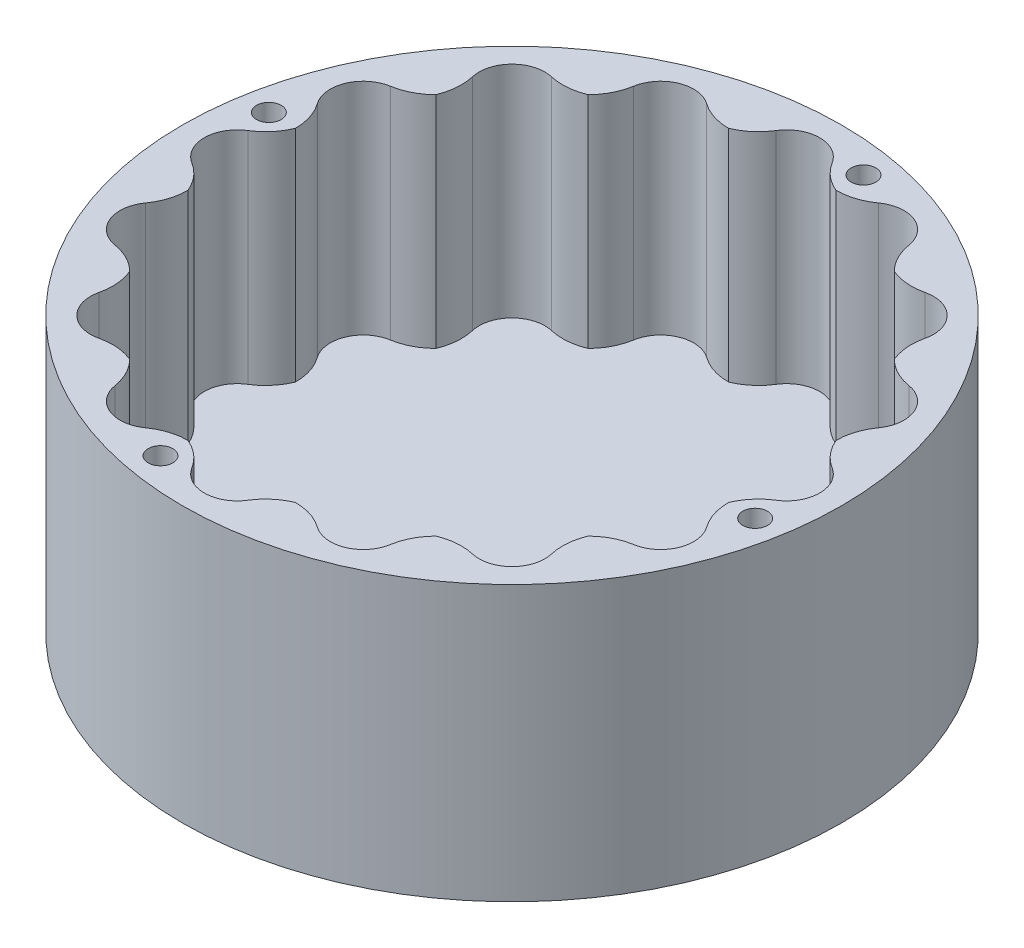
from build123d import *

# Parameters (mm, degrees)
SKETCH1_R           = 59.999999999
BOSS_EXTRUDE1_DEPTH = 50
SKETCH3_R           = 59.999999999
BOSS_EXTRUDE2_DEPTH = 10
FILLET1_R           = 10
FILLET2_R           = 10
SKETCH5_R           = 2.25
CUT_EXTRUDE2_DEPTH  = 6.1


with BuildPart() as part:
    # Sketch1 → Boss-Extrude1 (new body)
    with BuildSketch(Plane(origin=(0, 0, 0), x_dir=(1, 0, 0), z_dir=(0, 1, 0))):
        with Locations(Location((-1.875, 3e-09, 0), (0, 0, 270))):
            Circle(SKETCH1_R)
        with BuildLine():
            ThreePointArc((-50.028343877, 13.463115287), (-50.914264017, 9.754516103), (-51.514999998, 5.989190263))
            ThreePointArc((-51.514999998, 5.989190263), (-57.874999995, 3e-09), (-51.514999998, -5.989190257))
            ThreePointArc((-51.514999998, -5.989190257), (-50.914264017, -9.754516098), (-50.028343877, -13.463115281))
            ThreePointArc((-50.028343877, -13.463115281), (-53.612253816, -21.430272208), (-45.444416106, -24.529695876))
            ThreePointArc((-45.444416106, -24.529695876), (-43.448480613, -27.778511647), (-41.210777663, -30.865783567))
            ThreePointArc((-41.210777663, -30.865783567), (-41.472979743, -39.59797974), (-32.74078357, -39.33577766))
            ThreePointArc((-32.74078357, -39.33577766), (-29.653511649, -41.57348061), (-26.404695879, -43.569416103))
            ThreePointArc((-26.404695879, -43.569416103), (-23.30527221, -51.737253813), (-15.338115284, -48.153343875))
            ThreePointArc((-15.338115284, -48.153343875), (-11.6295161, -49.039264015), (-7.86419026, -49.639999995))
            ThreePointArc((-7.86419026, -49.639999995), (-1.875, -55.999999992), (4.11419026, -49.639999995))
            ThreePointArc((4.11419026, -49.639999995), (7.8795161, -49.039264015), (11.588115284, -48.153343875))
            ThreePointArc((11.588115284, -48.153343875), (19.55527221, -51.737253813), (22.654695879, -43.569416103))
            ThreePointArc((22.654695879, -43.569416103), (25.903511649, -41.57348061), (28.99078357, -39.33577766))
            ThreePointArc((28.99078357, -39.33577766), (37.722979743, -39.59797974), (37.460777663, -30.865783567))
            ThreePointArc((37.460777663, -30.865783567), (39.698480613, -27.778511647), (41.694416106, -24.529695876))
            ThreePointArc((41.694416106, -24.529695876), (49.862253816, -21.430272208), (46.278343877, -13.463115281))
            ThreePointArc((46.278343877, -13.463115281), (47.164264017, -9.754516098), (47.764999998, -5.989190257))
            ThreePointArc((47.764999998, -5.989190257), (54.124999995, 3e-09), (47.764999998, 5.989190263))
            ThreePointArc((47.764999998, 5.989190263), (47.164264017, 9.754516103), (46.278343877, 13.463115287))
            ThreePointArc((46.278343877, 13.463115287), (49.862253816, 21.430272213), (41.694416106, 24.529695882))
            ThreePointArc((41.694416106, 24.529695882), (39.698480613, 27.778511652), (37.460777663, 30.865783572))
            ThreePointArc((37.460777663, 30.865783572), (37.722979743, 39.597979745), (28.99078357, 39.335777666))
            ThreePointArc((28.99078357, 39.335777666), (25.903511649, 41.573480616), (22.654695879, 43.569416109))
            ThreePointArc((22.654695879, 43.569416109), (19.55527221, 51.737253819), (11.588115284, 48.15334388))
            ThreePointArc((11.588115284, 48.15334388), (7.8795161, 49.03926402), (4.11419026, 49.64))
            ThreePointArc((4.11419026, 49.64), (-1.875, 55.999999998), (-7.86419026, 49.64))
            ThreePointArc((-7.86419026, 49.64), (-11.6295161, 49.03926402), (-15.338115284, 48.15334388))
            ThreePointArc((-15.338115284, 48.15334388), (-23.30527221, 51.737253819), (-26.404695879, 43.569416109))
            ThreePointArc((-26.404695879, 43.569416109), (-29.653511649, 41.573480616), (-32.74078357, 39.335777666))
            ThreePointArc((-32.74078357, 39.335777666), (-41.472979743, 39.597979745), (-41.210777663, 30.865783572))
            ThreePointArc((-41.210777663, 30.865783572), (-43.448480613, 27.778511652), (-45.444416106, 24.529695882))
            ThreePointArc((-45.444416106, 24.529695882), (-53.612253816, 21.430272213), (-50.028343877, 13.463115287))
        make_face(mode=Mode.SUBTRACT)
    extrude(amount=BOSS_EXTRUDE1_DEPTH)

    # Sketch3 → Boss-Extrude2 (add)
    with BuildSketch(Plane(origin=(0, 0, 0), x_dir=(1, 0, 0), z_dir=(0, 1, 0))):
        with Locations(Location((-1.875, 3e-09, 0), (0, 0, 270))):
            Circle(SKETCH3_R)
    extrude(amount=BOSS_EXTRUDE2_DEPTH)

    # Fillet1
    # the kernel refuses this fillet: 10 mm, written as the material it takes off along each edge
    with BuildSketch(Plane(origin=(11.588115284, 10, -48.15334388), x_dir=(-0.9762460203923251, 0, -0.2166649664070039), z_dir=(0, 1, 0))) as fillet1_piece_1:
        with BuildLine():
            CenterArc((5.962374186, -9.98529915), FILLET1_R, 93.107148893, 45.06938167)
            ThreePointArc((-1.489654942, -3.316921396), (-0.487517252, -1.774020699), (0, 0))
            ThreePointArc((0, 0), (2.710170085, -0.073504248), (5.420340169, 0))
        make_face()
    extrude(amount=53.550850423, mode=Mode.SUBTRACT)
    with BuildSketch(Plane(origin=(4.11419026, 10, -49.64), x_dir=(0.9848478099539646, 0, 0.17342085004081753), z_dir=(0, 1, 0))) as fillet1_piece_2:
        with BuildLine():
            CenterArc((5.962374186, 9.98529915), FILLET1_R, 221.823469437, 45.06938167)
            ThreePointArc((-1.489654942, 3.316921396), (-0.487517252, 1.774020699), (0, 0))
            ThreePointArc((0, 0), (2.710170085, 0.073504248), (5.420340169, 0))
        make_face()
    extrude(amount=53.550850423, mode=Mode.SUBTRACT)

    # Fillet2
    # the kernel refuses this fillet: 10 mm, written as the material it takes off along each edge
    with BuildSketch(Plane(origin=(-50.028343877, 10, -13.463115287), x_dir=(-0.8017919038554878, 0, -0.5976033324135602), z_dir=(0, 1, 0)), Plane(origin=(-51.514999998, 10, 5.989190257), x_dir=(-0.9694520237461802, 0, -0.24528100956746685), z_dir=(0, 1, 0)), Plane(origin=(-45.444416106, 10, 24.529695876), x_dir=(-0.9895218611259949, 0, 0.14438312350737928), z_dir=(0, 1, 0)), Plane(origin=(-32.74078357, 10, 39.33577766), x_dir=(-0.8589459651873854, 0, 0.5120662348645055), z_dir=(0, 1, 0)), Plane(origin=(-15.338115284, 10, 48.153343875), x_dir=(-0.5976033324135606, 0, 0.8017919038554876), z_dir=(0, 1, 0)), Plane(origin=(-41.210777663, 10, -30.865783572), x_dir=(-0.512066234864506, 0, -0.8589459651873851), z_dir=(0, 1, 0)), Plane(origin=(-26.404695879, 10, -43.569416109), x_dir=(-0.14438312350738092, 0, -0.9895218611259947), z_dir=(0, 1, 0)), Plane(origin=(-7.86419026, 10, -49.64), x_dir=(0.2452810095674737, 0, -0.9694520237461783), z_dir=(0, 1, 0)), Plane(origin=(4.11419026, 10, 49.639999995), x_dir=(-0.24528100956747004, 0, 0.9694520237461793), z_dir=(0, 1, 0)), Plane(origin=(22.654695879, 10, 43.569416103), x_dir=(0.14438312350738092, 0, 0.9895218611259947), z_dir=(0, 1, 0)), Plane(origin=(37.460777663, 10, 30.865783567), x_dir=(0.5120662348645055, 0, 0.8589459651873854), z_dir=(0, 1, 0)), Plane(origin=(46.278343877, 10, 13.463115281), x_dir=(0.8017919038554872, 0, 0.5976033324135612), z_dir=(0, 1, 0)), Plane(origin=(47.764999998, 10, -5.989190263), x_dir=(0.9694520237461796, 0, 0.24528100956746887), z_dir=(0, 1, 0)), Plane(origin=(41.694416106, 10, -24.529695882), x_dir=(0.9895218611259945, 0, -0.14438312350738228), z_dir=(0, 1, 0)), Plane(origin=(28.99078357, 10, -39.335777666), x_dir=(0.8589459651873865, 0, -0.5120662348645036), z_dir=(0, 1, 0))) as fillet2_piece_1:
        with BuildLine():
            CenterArc((6.666136994, 9.529885762), FILLET2_R, 207.292364441, 45.06938167)
            ThreePointArc((-2.220646476, 4.944574479), (-1.043270762, 2.502401023), (0, 0))
            ThreePointArc((0, 0), (1.818037362, 0.282068543), (3.636074723, 0))
        make_face()
    extrude(amount=53.550850423, mode=Mode.SUBTRACT)
    with BuildSketch(Plane(origin=(-51.514999998, 10, -5.989190263), x_dir=(0.17342085004081384, 0, -0.9848478099539651), z_dir=(0, 1, 0)), Plane(origin=(-50.028343877, 10, 13.463115281), x_dir=(-0.21666496640700172, 0, -0.9762460203923256), z_dir=(0, 1, 0)), Plane(origin=(-41.210777663, 10, 30.865783567), x_dir=(-0.5737655057921729, 0, -0.8190196239181647), z_dir=(0, 1, 0)), Plane(origin=(-26.404695879, 10, 43.569416103), x_dir=(-0.8435154481177425, 0, -0.5371049141338442), z_dir=(0, 1, 0)), Plane(origin=(-7.86419026, 10, 49.639999995), x_dir=(-0.9848478099539649, 0, -0.17342085004081545), z_dir=(0, 1, 0)), Plane(origin=(-45.444416106, 10, -24.529695882), x_dir=(0.537104914133847, 0, -0.8435154481177406), z_dir=(0, 1, 0)), Plane(origin=(-32.74078357, 10, -39.335777666), x_dir=(0.8190196239181653, 0, -0.5737655057921723), z_dir=(0, 1, 0)), Plane(origin=(-15.338115284, 10, -48.15334388), x_dir=(0.9762460203923244, 0, -0.21666496640700658), z_dir=(0, 1, 0)), Plane(origin=(11.588115284, 10, 48.153343875), x_dir=(-0.9762460203923242, 0, 0.2166649664070072), z_dir=(0, 1, 0)), Plane(origin=(28.99078357, 10, 39.33577766), x_dir=(-0.8190196239181662, 0, 0.5737655057921711), z_dir=(0, 1, 0)), Plane(origin=(41.694416106, 10, 24.529695876), x_dir=(-0.5371049141338422, 0, 0.8435154481177437), z_dir=(0, 1, 0)), Plane(origin=(47.764999998, 10, 5.989190257), x_dir=(-0.17342085004081517, 0, 0.984847809953965), z_dir=(0, 1, 0)), Plane(origin=(46.278343877, 10, -13.463115287), x_dir=(0.21666496640700275, 0, 0.9762460203923252), z_dir=(0, 1, 0)), Plane(origin=(37.460777663, 10, -30.865783572), x_dir=(0.5737655057921707, 0, 0.8190196239181664), z_dir=(0, 1, 0))) as fillet2_piece_2:
        with BuildLine():
            CenterArc((5.962374186, 9.98529915), FILLET2_R, 221.823469437, 45.06938167)
            ThreePointArc((-1.489654942, 3.316921396), (-0.487517252, 1.774020699), (0, 0))
            ThreePointArc((0, 0), (2.710170085, 0.073504248), (5.420340169, 0))
        make_face()
    extrude(amount=53.550850423, mode=Mode.SUBTRACT)
    with BuildSketch(Plane(origin=(22.654695879, 10, -43.569416109), x_dir=(0.14438312350738122, 0, -0.9895218611259947), z_dir=(0, 1, 0))) as fillet2_piece_3:
        with BuildLine():
            CenterArc((6.666136994, -9.529885762), FILLET2_R, 107.638253889, 45.06938167)
            ThreePointArc((-2.220646476, -4.944574479), (-1.043270762, -2.502401023), (0, 0))
            ThreePointArc((0, 0), (1.818037362, -0.282068543), (3.636074723, 0))
        make_face()
    extrude(amount=53.550850423, mode=Mode.SUBTRACT)

    # Sketch5 → Cut-Extrude2 (cut)
    with BuildSketch(Plane(origin=(0, 50, 0), x_dir=(1, 0, 0), z_dir=(0, 1, 0))):
        with Locations(Location((7.985878763, 54.108807696, 0), (0, 0, 270))):
            Circle(SKETCH5_R)
        with Locations(Location((-55.983807694, 9.860878766, 0), (0, 0, 270))):
            Circle(SKETCH5_R)
        with Locations(Location((-11.735878763, -54.108807691, 0), (0, 0, 270))):
            Circle(SKETCH5_R)
        with Locations(Location((52.233807694, -9.86087876, 0), (0, 0, 270))):
            Circle(SKETCH5_R)
    extrude(amount=-CUT_EXTRUDE2_DEPTH, mode=Mode.SUBTRACT)


solid = part.part
